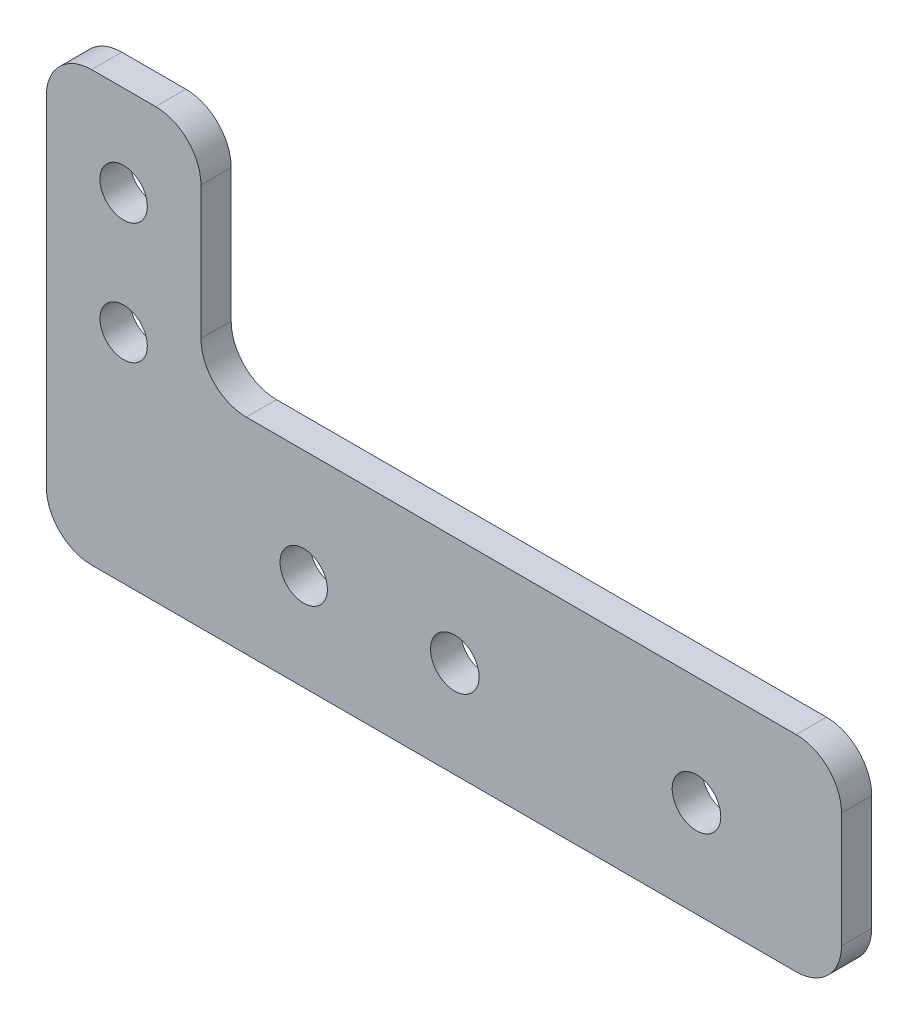
from build123d import *

# Parameters (mm, degrees)
SKETCH1_R           = 2.4892
SKETCH1_R_2         = 2.5527
BOSS_EXTRUDE1_DEPTH = 3.175
FILLET1_R           = 4.7625


with BuildPart() as part:
    # Sketch1 → Boss-Extrude1 (new body)
    with BuildSketch(Plane.XY):
        Polygon((-37.846, 23.8125), (-37.846, -21.2725), (45.72, -21.2725), (45.72, 0.3175), (-21.59, 0.3175), (-21.59, 23.8125), align=None)
        with Locations((-10.795, -11.1125)):
            Circle(SKETCH1_R, mode=Mode.SUBTRACT)
        with Locations((5.08, -11.1125)):
            Circle(SKETCH1_R_2, mode=Mode.SUBTRACT)
        with Locations((30.48, -11.1125)):
            Circle(SKETCH1_R_2, mode=Mode.SUBTRACT)
        with Locations((-29.718, 1.5875)):
            Circle(SKETCH1_R, mode=Mode.SUBTRACT)
        with Locations((-29.718, 14.2875)):
            Circle(SKETCH1_R, mode=Mode.SUBTRACT)
    extrude(amount=BOSS_EXTRUDE1_DEPTH)

    # Fillet1
    fillet1_edges = [part.edges().sort_by_distance(p)[0] for p in [
        (-37.846, 23.8125, 1.5875),
        (-21.59, 23.8125, 1.5875),
        (-21.59, 0.3175, 1.5875),
        (45.72, 0.3175, 1.5875),
        (45.72, -21.2725, 1.5875),
        (-37.846, -21.2725, 1.5875),
    ]]
    fillet(fillet1_edges, radius=FILLET1_R)


solid = part.part
